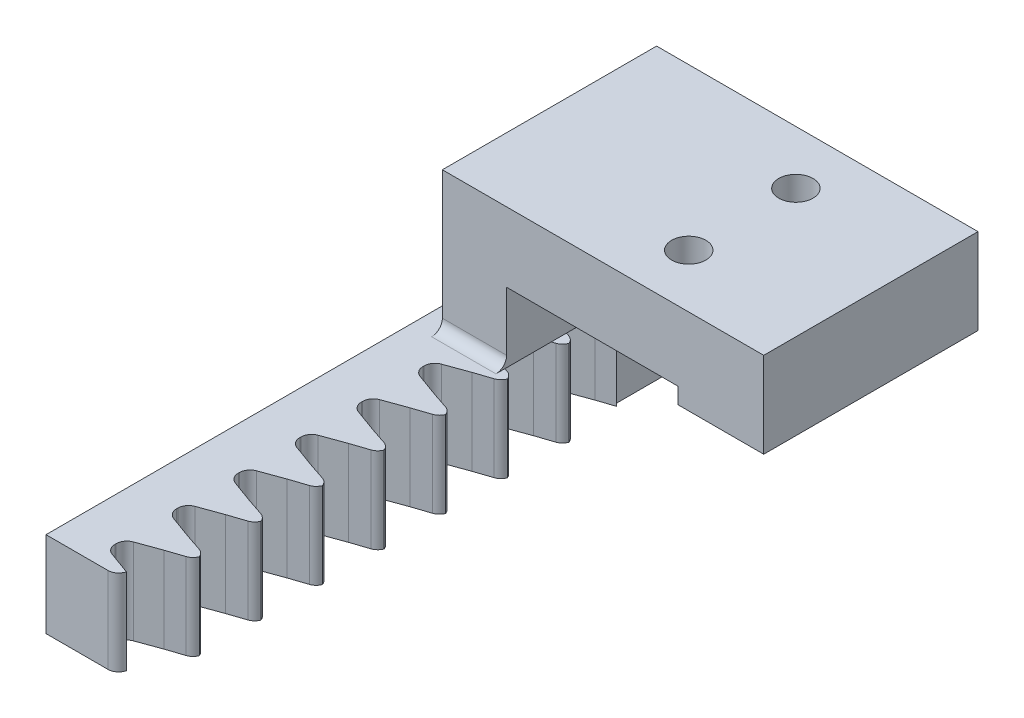
from build123d import *

# Parameters (mm, degrees)
SKETCH1_W           = 30
SKETCH1_H           = 16
BOSS_EXTRUDE1_DEPTH = 20
CUT_EXTRUDE1_DEPTH  = 20
SKETCH3_W           = 6
SKETCH3_H           = 10
BOSS_EXTRUDE2_DEPTH = 5
SKETCH9_R           = 1.6
CUT_EXTRUDE3_DEPTH  = 6.5
SKETCH11_W          = 10
SKETCH11_H          = 8
BOSS_EXTRUDE4_DEPTH = 40
CHAMFER2_SIZE2      = 10
CHAMFER2_SIZE       = 2
FILLET1_R           = 1
CUT_EXTRUDE4_DEPTH  = 8
SKETCH13_W          = 2
SKETCH13_H          = 8
BOSS_EXTRUDE5_DEPTH = 10
LPATTERN1_COUNT     = 8
LPATTERN1_PITCH     = 5.75
FILLET2_R           = 1
FILLET3_R           = 1
SKETCH14_W          = 2
SKETCH14_H          = 8
CUT_EXTRUDE5_DEPTH  = 5


# Some blends are built 0.0001 mm under size
with BuildPart() as part:
    # Sketch1 → Boss-Extrude1 (new body)
    with BuildSketch(Plane.XY):
        with Locations((15, -8)):
            Rectangle(SKETCH1_W, SKETCH1_H)
    extrude(amount=BOSS_EXTRUDE1_DEPTH)

    # Sketch2 → Cut-Extrude1 (cut)
    with BuildSketch(Plane.XY.offset(20)):
        Polygon((22, -6.5), (22, -8), (30, -8), (30, -16), (6, -16), (6, -6.5), align=None)
    extrude(amount=-CUT_EXTRUDE1_DEPTH, mode=Mode.SUBTRACT)

    # Sketch3 → Boss-Extrude2 (add)
    with BuildSketch(Plane.XZ.offset(16)):
        with Locations((3, 10)):
            Rectangle(SKETCH3_W, SKETCH3_H)
    extrude(amount=BOSS_EXTRUDE2_DEPTH)

    # Sketch9 → Cut-Extrude3 (cut)
    with BuildSketch(Plane.XZ.offset(6.5)):
        with Locations(Location((18, 15, 0), (0, 0, 270))):
            Circle(SKETCH9_R)
        with Locations(Location((18, 5, 0), (0, 0, 270))):
            Circle(SKETCH9_R)
    extrude(amount=-CUT_EXTRUDE3_DEPTH, mode=Mode.SUBTRACT)

    # Sketch11 → Boss-Extrude4 (add)
    with BuildSketch(Plane.XY.offset(15)):
        with Locations((3, -17)):
            Rectangle(SKETCH11_W, SKETCH11_H)
    extrude(amount=BOSS_EXTRUDE4_DEPTH)

    # Chamfer2
    chamfer2_edges = [part.edges().sort_by_distance(p)[0] for p in [
        (0, -17, 15),
    ]]
    chamfer2_side = [part.faces().sort_by_distance(p)[0] for p in [
        (-0.04, -17, 15),
    ]]
    chamfer(chamfer2_edges, length=CHAMFER2_SIZE - 0.0001, length2=CHAMFER2_SIZE2 - 0.0001, reference=chamfer2_side[0])  # a hair under: the kernel refuses the full size

    # Fillet1
    fillet1_edges = [part.edges().sort_by_distance(p)[0] for p in [
        (3, -13, 20),
    ]]
    fillet(fillet1_edges, radius=FILLET1_R)

    # Sketch12 → Cut-Extrude4 (cut)
    with BuildSketch(Plane.XZ.offset(21)):
        Polygon((7, 55), (4.75, 54.25), (2, 53.25), (2, 51.75), (4.75, 50.75), (7, 50), (7, 49.25), (8, 49.25), (8, 55), align=None)
    cut_extrude4 = extrude(amount=-CUT_EXTRUDE4_DEPTH, mode=Mode.SUBTRACT)

    # Sketch13 → Boss-Extrude5 (add)
    with BuildSketch(Plane(origin=(0, 0, 15), x_dir=(-1, 0, 0), z_dir=(0, 0, -1))):
        with Locations((-7, -17)):
            Rectangle(SKETCH13_W, SKETCH13_H)
    extrude(amount=BOSS_EXTRUDE5_DEPTH)

    # LPattern1: Cut-Extrude4 ×8
    with Locations(*[(0, 0, -i * LPATTERN1_PITCH) for i in range(1, LPATTERN1_COUNT)]):
        add(cut_extrude4, mode=Mode.SUBTRACT)

    # Fillet2
    # the kernel refuses this fillet: 1 mm, written as the material it adds along each edge
    with BuildSketch(Plane(origin=(2, -21, 51.75), x_dir=(0.9397934234884382, 0, -0.3417430630867014), z_dir=(0, 1, 0)), Plane(origin=(2, -21, 53.25), x_dir=(0, 0, -1), z_dir=(0, 1, 0)), Plane(origin=(2, -21, 46), x_dir=(0.9397934234884356, 0, -0.34174306308670804), z_dir=(0, 1, 0)), Plane(origin=(2, -21, 47.5), x_dir=(0, 0, -1), z_dir=(0, 1, 0)), Plane(origin=(2, -21, 40.25), x_dir=(0.9397934234884383, 0, -0.3417430630867007), z_dir=(0, 1, 0)), Plane(origin=(2, -21, 41.75), x_dir=(0, 0, -1), z_dir=(0, 1, 0)), Plane(origin=(2, -21, 28.75), x_dir=(0.939793423488437, 0, -0.3417430630867048), z_dir=(0, 1, 0)), Plane(origin=(2, -21, 30.25), x_dir=(0, 0, -1), z_dir=(0, 1, 0)), Plane(origin=(2, -21, 34.5), x_dir=(0.9397934234884383, 0, -0.3417430630867007), z_dir=(0, 1, 0)), Plane(origin=(2, -21, 36), x_dir=(0, 0, -1), z_dir=(0, 1, 0)), Plane(origin=(2, -21, 24.5), x_dir=(0, 0, -1), z_dir=(0, 1, 0)), Plane(origin=(2, -21, 23), x_dir=(0.939793423488437, 0, -0.3417430630867048), z_dir=(0, 1, 0))) as fillet2_piece_1:
        with BuildLine():
            CenterArc((FILLET2_R * 0.700427264611, -FILLET2_R), FILLET2_R, 90, 70.016893478)
            Line((-FILLET2_R * 0.239366158878, -FILLET2_R * 0.658256936913), (0, 0))
            Line((0, 0), (FILLET2_R * 0.700427264611, 0))
        make_face()
    extrude(amount=8)
    with BuildSketch(Plane(origin=(2, -21, 11.5), x_dir=(0.939793423488437, 0, -0.3417430630867044), z_dir=(0, 1, 0)), Plane(origin=(2, -21, 13), x_dir=(0, 0, -1), z_dir=(0, 1, 0)), Plane(origin=(2, -21, 17.25), x_dir=(0.939793423488437, 0, -0.3417430630867048), z_dir=(0, 1, 0))) as fillet2_piece_2:
        with BuildLine():
            CenterArc((FILLET2_R * 0.700427264611, -FILLET2_R), FILLET2_R, 90, 70.016893478)
            Line((-FILLET2_R * 0.239366158878, -FILLET2_R * 0.658256936913), (0, 0))
            Line((0, 0), (FILLET2_R * 0.700427264611, 0))
        make_face()
    extrude(amount=9.751068162)
    with BuildSketch(Plane(origin=(2, -21, 18.75), x_dir=(0.9397934234884369, 0, 0.34174306308670505), z_dir=(0, 1, 0))) as fillet2_piece_3:
        with BuildLine():
            CenterArc((FILLET2_R * 0.700427264611, FILLET2_R), FILLET2_R, 199.983106522, 70.016893478)
            Line((-FILLET2_R * 0.239366158878, FILLET2_R * 0.658256936913), (0, 0))
            Line((0, 0), (FILLET2_R * 0.700427264611, 0))
        make_face()
    extrude(amount=9.751068162)
    # the kernel refuses this fillet: 1 mm, written as the material it takes off along each edge
    with BuildSketch(Plane(origin=(7, -22.80189805, 26.25), x_dir=(-0.9486832980505139, 0, -0.31622776601683794), z_dir=(0, 1, 0)), Plane(origin=(7, -22.80189805, 27), x_dir=(0, 0, -1), z_dir=(0, 1, 0)), Plane(origin=(7, -22.80189805, 32), x_dir=(-0.9486832980505122, 0, -0.31622776601684277), z_dir=(0, 1, 0)), Plane(origin=(7, -22.80189805, 32.75), x_dir=(0, 0, -1), z_dir=(0, 1, 0)), Plane(origin=(7, -22.80189805, 37.75), x_dir=(-0.9486832980505133, 0, -0.31622776601683944), z_dir=(0, 1, 0)), Plane(origin=(7, -22.80189805, 38.5), x_dir=(0, 0, -1), z_dir=(0, 1, 0)), Plane(origin=(7, -22.80189805, 43.5), x_dir=(-0.9486832980505137, 0, -0.31622776601683833), z_dir=(0, 1, 0)), Plane(origin=(7, -22.80189805, 44.25), x_dir=(0, 0, -1), z_dir=(0, 1, 0)), Plane(origin=(7, -22.80189805, 49.25), x_dir=(-0.9486832980505137, 0, -0.31622776601683833), z_dir=(0, 1, 0)), Plane(origin=(7, -22.80189805, 50), x_dir=(0, 0, -1), z_dir=(0, 1, 0)), Plane(origin=(7, -22.80189805, 14.75), x_dir=(-0.9486832980505139, 0, -0.31622776601683794), z_dir=(0, 1, 0)), Plane(origin=(7, -22.80189805, 15.5), x_dir=(0, 0, -1), z_dir=(0, 1, 0)), Plane(origin=(7, -22.80189805, 20.5), x_dir=(-0.9486832980505137, 0, -0.3162277660168387), z_dir=(0, 1, 0)), Plane(origin=(7, -22.80189805, 21.25), x_dir=(0, 0, -1), z_dir=(0, 1, 0))) as fillet2_2_piece_1:
        with BuildLine():
            CenterArc((FILLET2_R * 0.720759220056, FILLET2_R), FILLET2_R, 198.434948823, 71.565051177)
            Line((-FILLET2_R * 0.227924077994, FILLET2_R * 0.683772233983), (0, 0))
            Line((0, 0), (FILLET2_R * 0.720759220056, 0))
        make_face()
    extrude(amount=11.6037961, mode=Mode.SUBTRACT)

    # Fillet3
    # the kernel refuses this fillet: 1 mm, written as the material it takes off along each edge
    with BuildSketch(Plane(origin=(7, -29.045614591, 55), x_dir=(-1, 0, 0), z_dir=(0, 1, 0))) as fillet3_piece_1:
        with BuildLine():
            CenterArc((3.218245837, -1), FILLET3_R, 90, 75.522487814)
            Line((2.25, -0.75), (2.230635083, -0.745))
            ThreePointArc((2.230635083, -0.745), (1.118675445, -0.393973666), (-0.006324555, -0.018973666))
            Line((-0.006324555, -0.018973666), (0, 0.02))
            Line((0, 0.02), (3.218245837, 0.02))
            Line((3.218245837, 0.02), (3.218245837, 0))
        make_face()
    extrude(amount=24.091229183, mode=Mode.SUBTRACT)

    # Sketch14 → Cut-Extrude5 (cut)
    with BuildSketch(Plane(origin=(0, 0, 5), x_dir=(-1, 0, 0), z_dir=(0, 0, -1))):
        with Locations((-7, -17)):
            Rectangle(SKETCH14_W, SKETCH14_H)
    extrude(amount=-CUT_EXTRUDE5_DEPTH, mode=Mode.SUBTRACT)


solid = part.part
